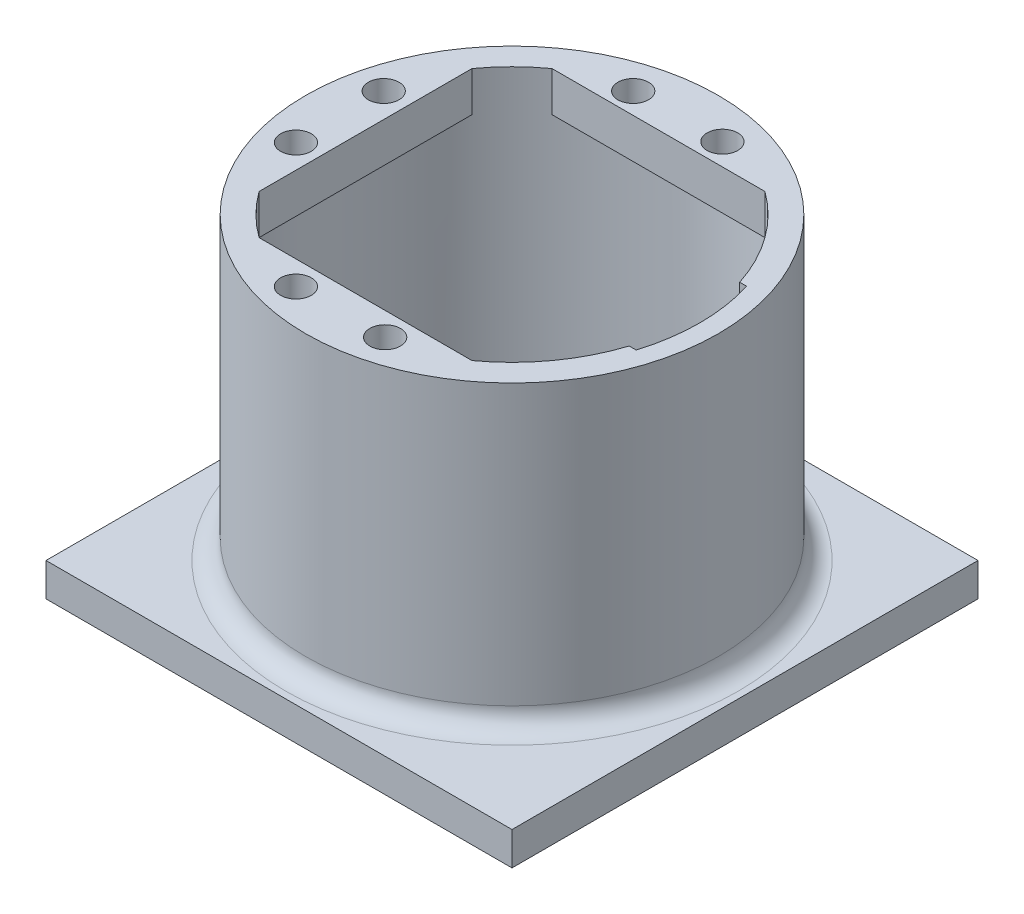
from build123d import *

# Parameters (mm, degrees)
SKETCH1_R           = 31
BOSS_EXTRUDE1_DEPTH = 50
BOSS_EXTRUDE2_DEPTH = 6
SKETCH3_R           = 2.3
CUT_EXTRUDE1_DEPTH  = 4
BOSS_EXTRUDE3_START = -5
SKETCH5_W           = 70
SKETCH5_H           = 70
SKETCH5_R           = 31
BOSS_EXTRUDE3_DEPTH = 5
FILLET1_R           = 3


with BuildPart() as part:
    # Sketch1 → Boss-Extrude1 (new body)
    with BuildSketch(Plane(origin=(0, 0, 0), x_dir=(1, 0, 0), z_dir=(0, 1, 0))):
        Circle(SKETCH1_R)
        with BuildLine():
            Line((25.902702562, -8.3), (26.950881247, -8.3))
            ThreePointArc((26.950881247, -8.3), (28.2, 0), (26.950881247, 8.3))
            Line((26.950881247, 8.3), (25.902702562, 8.3))
            ThreePointArc((25.902702562, 8.3), (-27.2, 0), (25.902702562, -8.3))
        make_face(mode=Mode.SUBTRACT)
    extrude(amount=-BOSS_EXTRUDE1_DEPTH)

    # Sketch2 → Boss-Extrude2 (add)
    with BuildSketch(Plane(origin=(0, 0, 0), x_dir=(1, 0, 0), z_dir=(0, 1, 0))):
        with BuildLine():
            Line((15.994999219, -22), (-15.994999219, -22))
            ThreePointArc((-15.994999219, -22), (0, -27.2), (15.994999219, -22))
        make_face()
        with BuildLine():
            Line((-15.994999219, 22), (15.994999219, 22))
            ThreePointArc((15.994999219, 22), (0, 27.2), (-15.994999219, 22))
        make_face()
        with BuildLine():
            Line((-22, -15.994999219), (-22, 15.994999219))
            ThreePointArc((-22, 15.994999219), (-27.2, 0), (-22, -15.994999219))
        make_face()
    extrude(amount=-BOSS_EXTRUDE2_DEPTH)

    # Sketch3 → Cut-Extrude1 (cut)
    with BuildSketch(Plane(origin=(0, 0, 0), x_dir=(1, 0, 0), z_dir=(0, 1, 0))):
        with Locations((-25.706913001, 6.43464249)):
            Circle(SKETCH3_R)
        with Locations((-25.597034397, -6.858704695)):
            Circle(SKETCH3_R)
        with Locations((-6.968583299, 25.172972192)):
            Circle(SKETCH3_R)
        with Locations((6.324763887, 25.282850796)):
            Circle(SKETCH3_R)
        with Locations((6.43464249, -25.487155793)):
            Circle(SKETCH3_R)
        with Locations((-6.858704695, -25.597034397)):
            Circle(SKETCH3_R)
    extrude(amount=-CUT_EXTRUDE1_DEPTH, mode=Mode.SUBTRACT)

    # Sketch5 → Boss-Extrude3 (add)
    with BuildSketch(Plane.XZ.offset(50).offset(BOSS_EXTRUDE3_START)):
        Rectangle(SKETCH5_W, SKETCH5_H)
        Circle(SKETCH5_R, mode=Mode.SUBTRACT)
    extrude(amount=BOSS_EXTRUDE3_DEPTH)

    # Fillet1
    fillet1_edges = [part.edges().sort_by_distance(p)[0] for p in [
        (-31, -45, 0),
    ]]
    fillet(fillet1_edges, radius=FILLET1_R)


solid = part.part
